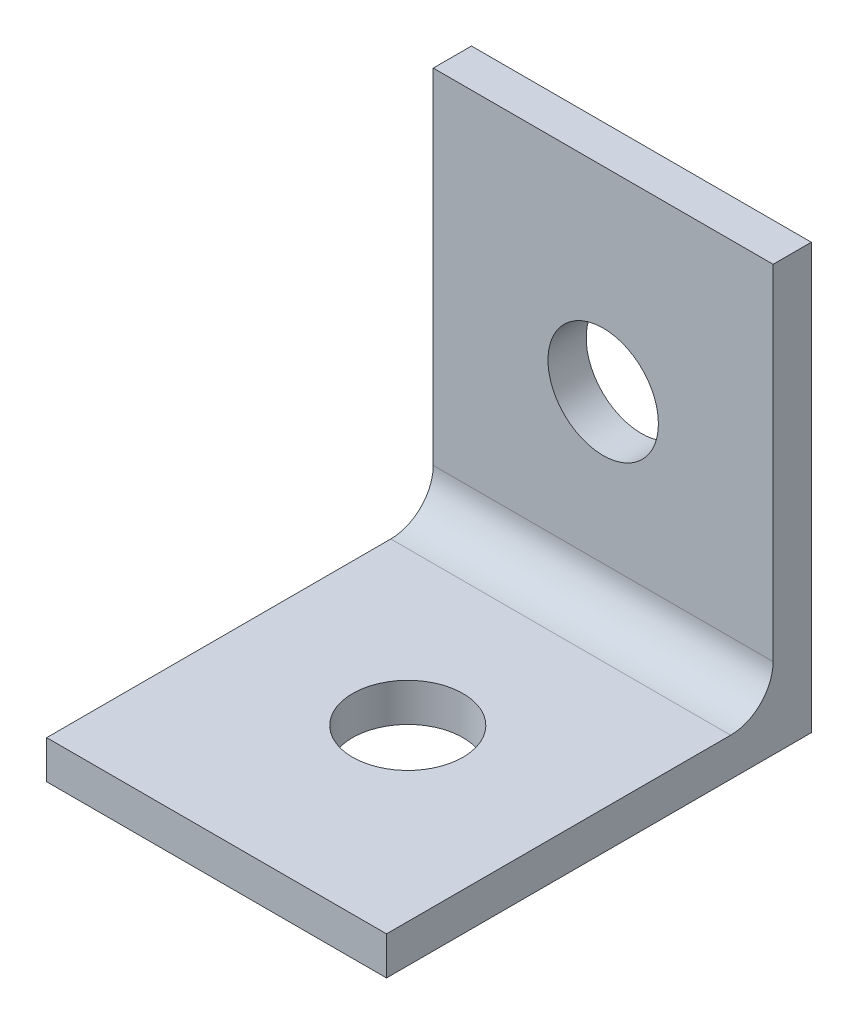
from build123d import *

# Parameters (mm, degrees)
SKETCH1_W           = 16
SKETCH1_H           = 20
BOSS_EXTRUDE1_DEPTH = 1.8
SKETCH2_W           = 16
SKETCH2_H           = 18.2
BOSS_EXTRUDE2_DEPTH = 1.8
SKETCH3_R           = 2.6
CUT_EXTRUDE1_DEPTH  = 1.8
SKETCH4_R           = 2.6
CUT_EXTRUDE2_DEPTH  = 1.8
FILLET1_R           = 2


with BuildPart() as part:
    # Sketch1 → Boss-Extrude1 (new body)
    with BuildSketch(Plane.XY):
        with Locations((8, 10)):
            Rectangle(SKETCH1_W, SKETCH1_H)
    extrude(amount=BOSS_EXTRUDE1_DEPTH)

    # Sketch2 → Boss-Extrude2 (add)
    with BuildSketch(Plane.XZ):
        with Locations((8, 10.9)):
            Rectangle(SKETCH2_W, SKETCH2_H)
    extrude(amount=-BOSS_EXTRUDE2_DEPTH)

    # Sketch3 → Cut-Extrude1 (cut)
    with BuildSketch(Plane.XY.offset(1.8)):
        with Locations((8, 10.8)):
            Circle(SKETCH3_R)
    extrude(amount=-CUT_EXTRUDE1_DEPTH, mode=Mode.SUBTRACT)

    # Sketch4 → Cut-Extrude2 (cut)
    with BuildSketch(Plane(origin=(0, 1.8, 0), x_dir=(1, 0, 0), z_dir=(0, 1, 0))):
        with Locations((8, -11)):
            Circle(SKETCH4_R)
    extrude(amount=-CUT_EXTRUDE2_DEPTH, mode=Mode.SUBTRACT)

    # Fillet1
    fillet1_edges = [part.edges().sort_by_distance(p)[0] for p in [
        (8, 1.8, 1.8),
    ]]
    fillet(fillet1_edges, radius=FILLET1_R)


solid = part.part
